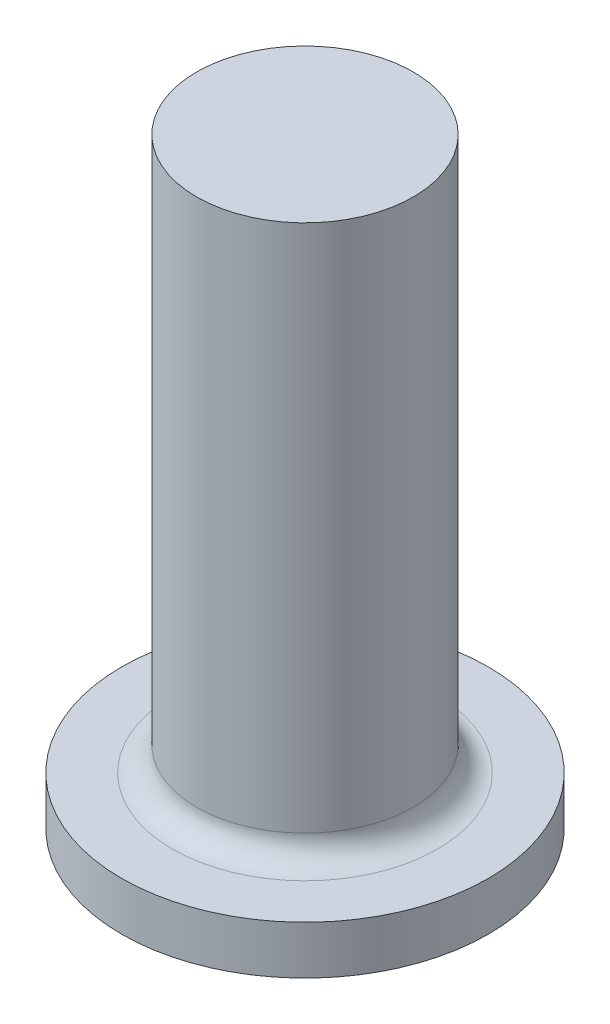
from build123d import *

# Parameters (mm, degrees)
SKETCH1_R           = 37.9
BOSS_EXTRUDE1_DEPTH = 10
SKETCH2_R           = 22.4
BOSS_EXTRUDE2_DEPTH = 114.3
FILLET1_R           = 5


with BuildPart() as part:
    # Sketch1 → Boss-Extrude1 (new body)
    with BuildSketch(Plane(origin=(0, 0, 0), x_dir=(1, 0, 0), z_dir=(0, 1, 0))):
        Circle(SKETCH1_R)
    extrude(amount=BOSS_EXTRUDE1_DEPTH)

    # Sketch2 → Boss-Extrude2 (add)
    with BuildSketch(Plane(origin=(0, 10, 0), x_dir=(1, 0, 0), z_dir=(0, 1, 0))):
        Circle(SKETCH2_R)
    extrude(amount=BOSS_EXTRUDE2_DEPTH)

    # Fillet1
    fillet1_edges = [part.edges().sort_by_distance(p)[0] for p in [
        (-22.4, 10, 0),
    ]]
    fillet(fillet1_edges, radius=FILLET1_R)


solid = part.part
